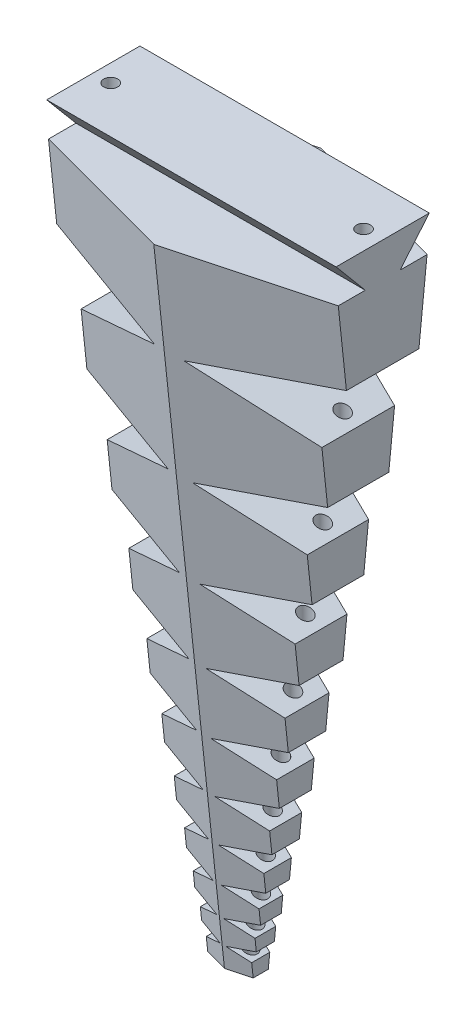
from build123d import *

# Parameters (mm, degrees)
CUT_EXTRUDE2_DEPTH      = 104.832798419
CUT_EXTRUDE2_DEPTH_BACK = 104.832798419
SKETCH17_R              = 1
CUT_EXTRUDE3_DEPTH      = 20
SKETCH22_R              = 1
CUT_EXTRUDE4_DEPTH      = 20
SKETCH23_R              = 1
CUT_EXTRUDE5_DEPTH      = 15
SKETCH24_R              = 1
CUT_EXTRUDE6_DEPTH      = 12
SKETCH25_R              = 1
CUT_EXTRUDE7_DEPTH      = 10
SKETCH26_R              = 1
CUT_EXTRUDE8_DEPTH      = 8
SKETCH27_R              = 1
CUT_EXTRUDE9_DEPTH      = 6
SKETCH28_R              = 1
CUT_EXTRUDE10_DEPTH     = 6
SKETCH29_R              = 1
CUT_EXTRUDE11_DEPTH     = 5
SKETCH30_R              = 1
CUT_EXTRUDE12_DEPTH     = 4
SKETCH16_R              = 1
CUT_EXTRUDE13_DEPTH     = 3
CUT_EXTRUDE14_DEPTH     = 50


with BuildPart() as part:
    # Sketch2 → Loft1 section 0
    with BuildSketch(Plane(origin=(0, 0, 0), x_dir=(1, 0, 0), z_dir=(0, 1, 0))):
        with BuildLine():
            Line((0.013558001, 1.959309758), (-3.238400261, 1.087950168))
            Line((-3.238400261, 1.087950168), (-3.238400261, -1.087950168))
            Line((-3.238400261, -1.087950168), (0.013558001, -1.959309758))
            Line((0.013558001, -1.959309758), (3.265516264, -1.087950168))
            Line((3.265516264, -1.087950168), (3.265516264, 1.087950168))
            Line((3.265516264, 1.087950168), (0.013558001, 1.959309758))
        make_face()
    # Sketch3 → Loft1 section 1
    with BuildSketch(Plane(origin=(0, 100, 0), x_dir=(1, 0, 0), z_dir=(0, 1, 0))):
        with BuildLine():
            Line((-0.123443963, 12.5), (-25, 5.834346899))
            Line((-25, 5.834346899), (-25, -5.834346899))
            Line((-25, -5.834346899), (-0.123443963, -12.5))
            Line((-0.123443963, -12.5), (24.753112074, -5.834346899))
            Line((24.753112074, -5.834346899), (24.753112074, 5.834346899))
            Line((24.753112074, 5.834346899), (-0.123443963, 12.5))
        make_face()
    loft()

    # spiral_flat → Cut-Extrude2 (cut, two sides: drawn at the far end of the back side and taken through both)
    with BuildSketch(Plane.XY.offset(-CUT_EXTRUDE2_DEPTH_BACK)):
        Polygon((-20.776742097, 100), (-25, 100), (-3.265516264, 0), (-3.265516264, 2.008489475), (-0.392929297, 3.054025626), (-3.929292967, 3.677581955), (-3.929292967, 5.470777811), (-0.472799459, 6.728838563), (-4.727994587, 7.479144272), (-4.727994587, 9.636840421), (-0.568904711, 11.150625338), (-5.689047114, 12.053444588), (-5.689047114, 14.64973247), (-0.684545138, 16.471222227), (-6.84545138, 17.557556223), (-6.84545138, 20.681587736), (-0.823691624, 22.873329044), (-8.236916245, 24.180480559), (-8.236916245, 27.939529377), (-0.991122213, 30.576782728), (-9.911222133, 32.149637014), (-9.911222133, 36.672782174), (-1.192586172, 39.846106147), (-11.925861724, 41.738672218), (-11.925861724, 47.181230462), (-1.435001415, 50.999591347), (-14.35001415, 53.276856548), (-14.35001415, 59.825715627), (-1.726692049, 64.420229129), (-17.266920487, 67.160390689), (-17.266920487, 75.040426751), (-2.07767421, 80.568860277), (-20.776742097, 83.866010459), align=None)
        Polygon((3.265516264, 2.008489475), (3.265516264, 0), (25, 100), (20.776742097, 100), (20.776742097, 83.866010459), (2.07767421, 80.568860277), (17.266920487, 75.040426751), (17.266920487, 67.160390689), (1.726692049, 64.420229129), (14.35001415, 59.825715627), (14.35001415, 53.276856548), (1.435001415, 50.999591347), (11.925861724, 47.181230462), (11.925861724, 41.738672218), (1.192586172, 39.846106147), (9.911222133, 36.672782174), (9.911222133, 32.149637014), (0.991122213, 30.576782728), (8.236916245, 27.939529377), (8.236916245, 24.180480559), (0.823691624, 22.873329044), (6.84545138, 20.681587736), (6.84545138, 17.557556223), (0.684545138, 16.471222227), (5.689047114, 14.64973247), (5.689047114, 12.053444588), (0.568904711, 11.150625338), (4.727994587, 9.636840421), (4.727994587, 7.479144272), (0.472799459, 6.728838563), (3.929292967, 5.470777811), (3.929292967, 3.677581955), (0.392929297, 3.054025626), align=None)
    extrude(amount=CUT_EXTRUDE2_DEPTH + CUT_EXTRUDE2_DEPTH_BACK, mode=Mode.SUBTRACT)

    # Sketch17 → Cut-Extrude3 (cut)
    with BuildSketch(Plane(origin=(0, 100, 0), x_dir=(1, 0, 0), z_dir=(0, 1, 0))):
        with Locations((-18.276742097, 0)):
            Circle(SKETCH17_R)
        with Locations((18.029854171, 0)):
            Circle(SKETCH17_R)
    extrude(amount=-CUT_EXTRUDE3_DEPTH, mode=Mode.SUBTRACT)

    # Sketch22 → Cut-Extrude4 (cut)
    with BuildSketch(Plane(origin=(0, 80.56886028, 0), x_dir=(-1, 0, 0), z_dir=(0, -1, 0))):
        with Locations((15.276742097, 0)):
            Circle(SKETCH22_R)
        with Locations((-15.029854171, 0)):
            Circle(SKETCH22_R)
    extrude(amount=CUT_EXTRUDE4_DEPTH, mode=Mode.SUBTRACT)

    # Sketch23 → Cut-Extrude5 (cut)
    with BuildSketch(Plane(origin=(0, 64.42022913, 0), x_dir=(-1, 0, 0), z_dir=(0, -1, 0))):
        with Locations((12.276742097, 0)):
            Circle(SKETCH23_R)
        with Locations((-12.166856135, 0)):
            Circle(SKETCH23_R)
    extrude(amount=CUT_EXTRUDE5_DEPTH, mode=Mode.SUBTRACT)

    # Sketch24 → Cut-Extrude6 (cut)
    with BuildSketch(Plane(origin=(0, 50.99959135, 0), x_dir=(-1, 0, 0), z_dir=(0, -1, 0))):
        with Locations((9.776742097, 0)):
            Circle(SKETCH24_R)
        with Locations((-9.666856135, 0)):
            Circle(SKETCH24_R)
    extrude(amount=CUT_EXTRUDE6_DEPTH, mode=Mode.SUBTRACT)

    # Sketch25 → Cut-Extrude7 (cut)
    with BuildSketch(Plane(origin=(0, 39.84610615, 0), x_dir=(-1, 0, 0), z_dir=(0, -1, 0))):
        with Locations((7.776742097, 0)):
            Circle(SKETCH25_R)
        with Locations((-7.775843858, 0.118194498)):
            Circle(SKETCH25_R)
    extrude(amount=CUT_EXTRUDE7_DEPTH, mode=Mode.SUBTRACT)

    # Sketch26 → Cut-Extrude8 (cut)
    with BuildSketch(Plane(origin=(0, 30.57678273, 0), x_dir=(-1, 0, 0), z_dir=(0, -1, 0))):
        with Locations((-6.166856135, 0)):
            Circle(SKETCH26_R)
        with Locations((6.276742097, 0)):
            Circle(SKETCH26_R)
    extrude(amount=CUT_EXTRUDE8_DEPTH, mode=Mode.SUBTRACT)

    # Sketch27 → Cut-Extrude9 (cut)
    with BuildSketch(Plane(origin=(0, 22.873329046, 0), x_dir=(-1, 0, 0), z_dir=(0, -1, 0))):
        with Locations((5.076742097, 0)):
            Circle(SKETCH27_R)
        with Locations((-4.966856135, 0)):
            Circle(SKETCH27_R)
    extrude(amount=CUT_EXTRUDE9_DEPTH, mode=Mode.SUBTRACT)

    # Sketch28 → Cut-Extrude10 (cut)
    with BuildSketch(Plane(origin=(0, 16.471222226, 0), x_dir=(-1, 0, 0), z_dir=(0, -1, 0))):
        with Locations((4.076742097, 0)):
            Circle(SKETCH28_R)
        with Locations((-3.966856135, 0)):
            Circle(SKETCH28_R)
    extrude(amount=CUT_EXTRUDE10_DEPTH, mode=Mode.SUBTRACT)

    # Sketch29 → Cut-Extrude11 (cut)
    with BuildSketch(Plane(origin=(0, 11.150625337, 0), x_dir=(-1, 0, 0), z_dir=(0, -1, 0))):
        with Locations((3.276742097, 0)):
            Circle(SKETCH29_R)
        with Locations((-3.276742097, 0)):
            Circle(SKETCH29_R)
    extrude(amount=CUT_EXTRUDE11_DEPTH, mode=Mode.SUBTRACT)

    # Sketch30 → Cut-Extrude12 (cut)
    with BuildSketch(Plane(origin=(0, 6.728838567, 0), x_dir=(-1, 0, 0), z_dir=(0, -1, 0))):
        with Locations((2.476742097, 0)):
            Circle(SKETCH30_R)
        with Locations((-2.476742097, 0)):
            Circle(SKETCH30_R)
    extrude(amount=CUT_EXTRUDE12_DEPTH, mode=Mode.SUBTRACT)

    # Sketch16 → Cut-Extrude13 (cut)
    with BuildSketch(Plane(origin=(0, 0, 0), x_dir=(-1, 0, 0), z_dir=(0, -1, 0))):
        with Locations((1.736441999, 0)):
            Circle(SKETCH16_R)
        with Locations((-1.763558001, 0)):
            Circle(SKETCH16_R)
    extrude(amount=-CUT_EXTRUDE13_DEPTH, mode=Mode.SUBTRACT)

    # Sketch31 → Cut-Extrude14 (cut)
    with BuildSketch(Plane(origin=(20.82988673, 0, 0), x_dir=(0, 0, -1), z_dir=(1, 0, 0))):
        Polygon((26.752720375, 95), (2.5, 95), (6.695498156, 100), (26.752720375, 100), align=None)
        Polygon((-6.695498156, 100), (-26.752720375, 100), (-26.752720375, 95), (-2.5, 95), align=None)
    extrude(amount=-CUT_EXTRUDE14_DEPTH, mode=Mode.SUBTRACT)


solid = part.part
